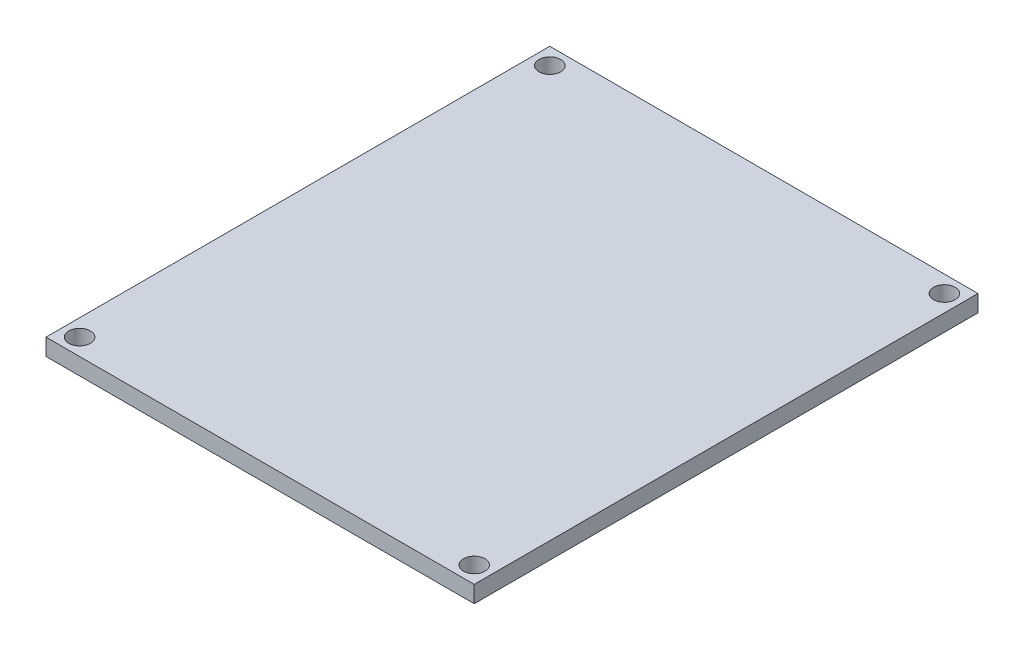
from build123d import *

# Parameters (mm, degrees)
SKETCH1_W                 = 64.77
SKETCH1_H                 = 76.2
BOSS_EXTRUDE1_DEPTH       = 2.54
F_4_CLEARANCE_HOLE1_D     = 3.2639
F_4_CLEARANCE_HOLE1_DEPTH = 10.16
F_4_CLEARANCE_HOLE1_TIP   = 0.980574487


with BuildPart() as part:
    # Sketch1 → Boss-Extrude1 (new body)
    with BuildSketch(Plane(origin=(0, 0, 0), x_dir=(1, 0, 0), z_dir=(0, 1, 0))):
        with Locations((32.385, 38.1)):
            Rectangle(SKETCH1_W, SKETCH1_H)
    extrude(amount=BOSS_EXTRUDE1_DEPTH)

    # #4 Clearance Hole1
    with Locations(Plane(origin=(0, 2.54, 0), x_dir=(1, 0, 0), z_dir=(0, 1, 0))):
        with Locations((2.54, 73.66), (2.54, 2.54), (62.23, 73.66), (62.23, 2.54)):
            Hole(F_4_CLEARANCE_HOLE1_D / 2, depth=F_4_CLEARANCE_HOLE1_DEPTH)
            with Locations((0, 0, -(F_4_CLEARANCE_HOLE1_DEPTH + F_4_CLEARANCE_HOLE1_TIP / 2))):  # 118° drill point
                Cone(0, F_4_CLEARANCE_HOLE1_D / 2, F_4_CLEARANCE_HOLE1_TIP, mode=Mode.SUBTRACT)


solid = part.part
